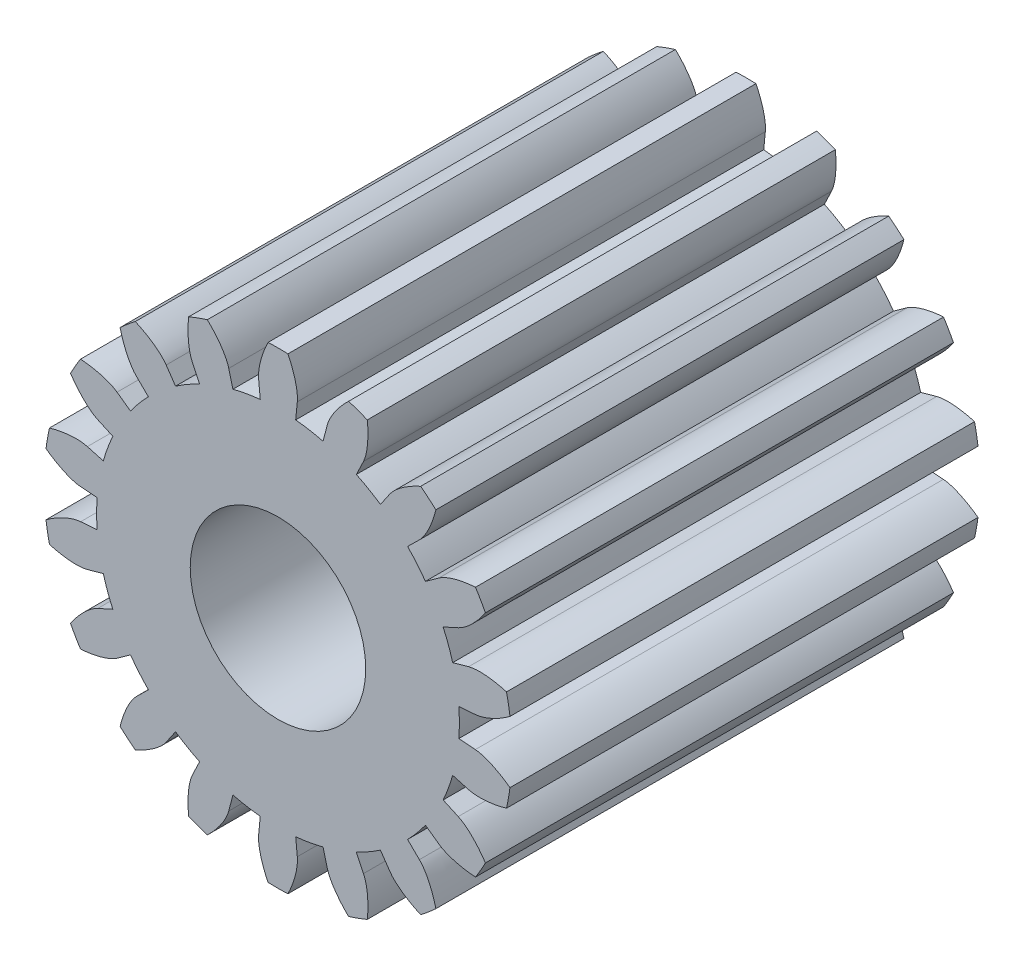
from build123d import *

# Parameters (mm, degrees)
SKETCH_1_R               = 4
SKETCH_1_R_2             = 1.5
EXTRUDE_1_DEPTH          = 8
CUT_EXTRUDE_1_DEPTH      = 10.797958971
PATTERN_CIRCULAR_1_COUNT = 18
PATTERN_CIRCULAR_1_ANGLE = 340


with BuildPart() as part:
    # 草图1 → 凸台-拉伸1 (new body)
    with BuildSketch(Plane.XY):
        Circle(SKETCH_1_R)
        Circle(SKETCH_1_R_2, mode=Mode.SUBTRACT)
    extrude(amount=EXTRUDE_1_DEPTH)

    # 草图1<3> → 切除-拉伸1 (cut, through all)
    with BuildSketch(Plane.XY):
        with BuildLine():
            Line((3.372934147, 0.259390116), (3.090873554, 0.237698696))
            ThreePointArc((3.090873554, 0.237698696), (3.097717548, 0.118936918), (3.1, 0))
            ThreePointArc((3.1, 0), (3.097717548, -0.118936918), (3.090873554, -0.237698696))
            Line((3.090873554, -0.237698696), (3.372934147, -0.259390116))
            add(Edge.make_bspline(
                [(3.372934147, -0.259390116), (3.398645112, -0.261367377), (3.469985009, -0.272228931), (3.601888731, -0.314088959), (3.750469983, -0.384940541), (3.868410508, -0.457922595), (3.94362423, -0.511065124), (3.965154522, -0.526829781)],
                knots=[0, 0, 0, 0, 0, 0.005604068, 0.015718248, 0.029959916, 0.035770966, 0.035770966, 0.035770966, 0.035770966, 0.035770966], degree=4))
            ThreePointArc((3.965154522, -0.526829781), (3.991279124, -0.263990448), (4, 0))
            ThreePointArc((4, 0), (3.991279124, 0.263990448), (3.965154522, 0.526829781))
            add(Edge.make_bspline(
                [(3.372934147, 0.259390116), (3.398645112, 0.261367377), (3.469985009, 0.272228931), (3.601888731, 0.314088959), (3.750469983, 0.384940541), (3.868410508, 0.457922595), (3.94362423, 0.511065124), (3.965154522, 0.526829781)],
                knots=[0, 0, 0, 0, 0, 0.005604068, 0.015718248, 0.029959916, 0.035770966, 0.035770966, 0.035770966, 0.035770966, 0.035770966], degree=4))
        make_face()
    cut_extrude_1 = extrude(amount=CUT_EXTRUDE_1_DEPTH, mode=Mode.SUBTRACT)

    # 阵列(圆周)1: 切除-拉伸1 ×18 about axis
    pattern_circular_1_axis = Axis((0, 0, 8), (0, 0, 1))
    for i in range(1, PATTERN_CIRCULAR_1_COUNT):
        add(cut_extrude_1.rotate(pattern_circular_1_axis, i * PATTERN_CIRCULAR_1_ANGLE / (PATTERN_CIRCULAR_1_COUNT - 1)), mode=Mode.SUBTRACT)


solid = part.part
